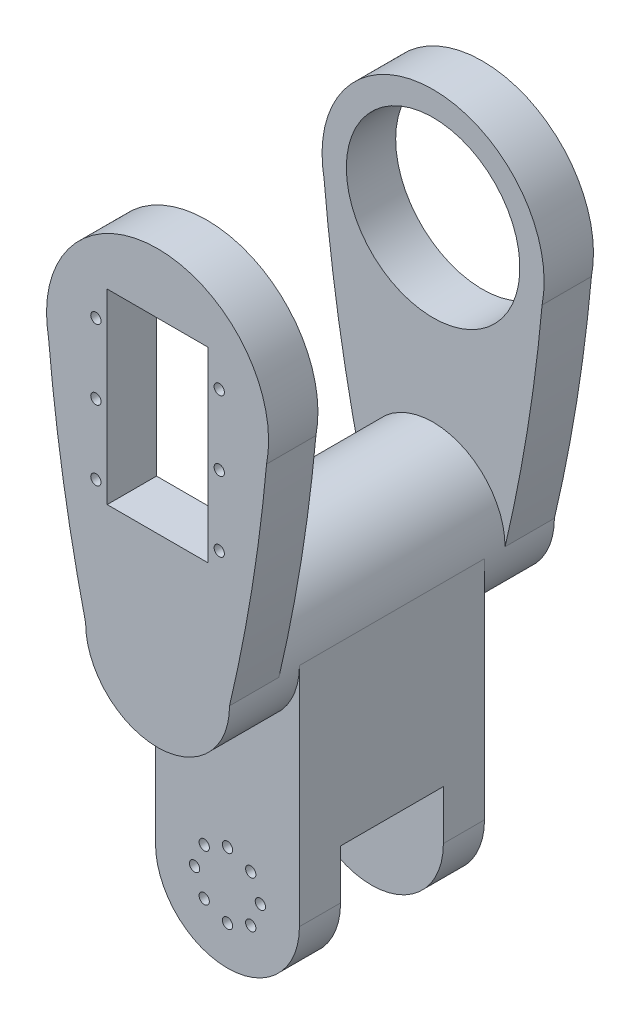
from build123d import *
from build123d.topology import SkipClean

# Parameters (mm, degrees)
BOSS_EXTRUDE1_DEPTH  = 45
BOSS_EXTRUDE2_DEPTH  = 5
BOSS_EXTRUDE3_DEPTH  = 12
BOSS_EXTRUDE4_START  = 5
BOSS_EXTRUDE4_DEPTH  = 5
BOSS_EXTRUDE5_START  = 12
BOSS_EXTRUDE5_DEPTH  = 12
BOSS_EXTRUDE6_START  = -12
BOSS_EXTRUDE6_DEPTH  = 12
BOSS_EXTRUDE7_DEPTH  = 12
CUT_EXTRUDE3_DEPTH   = 12
SKETCH15_R           = 21.100000000000012
CUT_EXTRUDE4_DEPTH   = 12
CUT_EXTRUDE5_DEPTH   = 139.06975520310718
SKETCH21_R           = 1.2500000000000013
SKETCH21_R_2         = 1.2500000000000016
SKETCH21_R_3         = 1.2500000000000036
SKETCH21_R_4         = 1.2500000000000064
SKETCH21_R_5         = 1.2500000000000004
SKETCH21_R_6         = 1.250000000000002
CUT_EXTRUDE7_DEPTH   = 12
SKETCH23_R           = 10.100000000000001
BOSS_EXTRUDE8_DEPTH  = 6
SKETCH24_R           = 8.5
CUT_EXTRUDE8_DEPTH   = 6
SKETCH25_R           = 2.7
CUT_EXTRUDE9_DEPTH   = 18
BOSS_EXTRUDE9_START  = -12
BOSS_EXTRUDE9_DEPTH  = 12
SKETCH30_R           = 1.2500000000000013
CUT_EXTRUDE11_DEPTH  = 12
SKETCH31_R           = 2.0000000000000036
SKETCH31_R_2         = 2.0000000000000067
SKETCH31_R_3         = 2
CUT_EXTRUDE12_DEPTH  = 2.5
BOSS_EXTRUDE11_DEPTH = 12


with BuildPart() as part:
    # Sketch2 → Boss-Extrude1 (new body)
    with BuildSketch(Plane.XY):
        with BuildLine():
            Line((-17.5, 27.5), (-17.5, -27.5))
            ThreePointArc((-17.5, -27.500000000000004), (3.74e-15, -45), (17.500000000000007, -27.5))
            Line((17.500000000000007, -27.5), (17.5, 27.5))
            ThreePointArc((17.5, 27.500000000000004), (7e-16, 45), (-17.5, 27.5))
        make_face()
    extrude(amount=BOSS_EXTRUDE1_DEPTH)

    # Sketch5 → Boss-Extrude2 (add)
    with BuildSketch(Plane.XY.offset(45)):
        with BuildLine():
            ThreePointArc((17.5, 27.5), (1.07e-15, 45), (-17.5, 27.5))
            ThreePointArc((-17.5, 27.5), (-3.21e-15, 10), (17.5, 27.5))
        make_face()
    extrude(amount=BOSS_EXTRUDE2_DEPTH)

    # Sketch6 → Boss-Extrude3 (add)
    with BuildSketch(Plane.XY.offset(49.99999999999999)):
        with BuildLine():
            Line((17.5, 27.5), (17.499999999999996, 67.5))
            ThreePointArc((17.499999999999996, 67.5), (-1.59e-15, 85), (-17.500000000000004, 67.5))
            Line((-17.5, 67.5), (-17.5, 27.5))
            ThreePointArc((-17.5, 27.5), (1.8e-16, 10.000000000000004), (17.5, 27.500000000000004))
        make_face()
    extrude(amount=BOSS_EXTRUDE3_DEPTH)

    # Sketch7 → Boss-Extrude4 (add)
    with BuildSketch(Plane(origin=(0, 0, 0), x_dir=(-1, 0, 0), z_dir=(0, 0, -1)).offset(BOSS_EXTRUDE4_START)):
        with BuildLine():
            ThreePointArc((17.5, 27.5), (1.07e-15, 10), (-17.5, 27.5))
            ThreePointArc((-17.5, 27.5), (1.07e-15, 45), (17.5, 27.5))
        make_face()
    extrude(amount=-BOSS_EXTRUDE4_DEPTH)

    # Sketch8 → Boss-Extrude5 (add)
    with BuildSketch(Plane(origin=(0, 0, -5), x_dir=(-1, 0, 0), z_dir=(0, 0, -1)).offset(BOSS_EXTRUDE5_START)):
        with BuildLine():
            Line((-17.499999999999996, 67.5), (-17.5, 27.5))
            ThreePointArc((-17.5, 27.5), (-1.96e-15, 10), (17.5, 27.499999999999996))
            Line((17.5, 27.5), (17.5, 67.5))
            ThreePointArc((17.5, 67.5), (1.96e-15, 85), (-17.5, 67.5))
        make_face()
    extrude(amount=-BOSS_EXTRUDE5_DEPTH)

    # Sketch11 → Boss-Extrude6 (add)
    with BuildSketch(Plane.XY.offset(62).offset(BOSS_EXTRUDE6_START)):
        with BuildLine():
            Line((-17.5, 67.5), (-17.5, 27.5))
            ThreePointArc((-17.5, 27.5), (-3.21e-15, 10), (17.5, 27.5))
            Line((17.5, 27.5), (17.499999999999996, 67.5))
            ThreePointArc((17.499999999999996, 67.5), (-6.69e-15, 115.06088519495209), (-17.5, 67.5))
        make_face()
    extrude(amount=BOSS_EXTRUDE6_DEPTH)

    # Sketch12 → Boss-Extrude7 (add)
    with BuildSketch(Plane(origin=(0, 0, -17), x_dir=(-1, 0, 0), z_dir=(0, 0, -1))):
        with BuildLine():
            ThreePointArc((17.5, 67.5), (-2.61e-15, 115.06088519495209), (-17.499999999999996, 67.5))
            ThreePointArc((-17.499999999999996, 67.5), (2.81e-15, 85), (17.5, 67.5))
        make_face()
    extrude(amount=-BOSS_EXTRUDE7_DEPTH)

    # Sketch14 → Cut-Extrude3 (cut)
    with BuildSketch(Plane.XY.offset(62)):
        Polygon((-12.25, 100.41088519495209), (12.25, 100.41088519495209), (12.250000000000004, 55.01088519495209), (-12.249999999999996, 55.01088519495209), align=None)
    extrude(amount=-CUT_EXTRUDE3_DEPTH, mode=Mode.SUBTRACT)

    # Sketch15 → Cut-Extrude4 (cut)
    with BuildSketch(Plane(origin=(0, 0, -17), x_dir=(-1, 0, 0), z_dir=(0, 0, -1))):
        with Locations((1.73e-15, 88.06088519495209)):
            Circle(SKETCH15_R)
    extrude(amount=-CUT_EXTRUDE4_DEPTH, mode=Mode.SUBTRACT)

    # Sketch17 → Cut-Extrude5 (cut, through all)
    with SkipClean():  # the faces are left unmerged after this step: merging them gives an invalid solid
        with BuildSketch(Plane.ZY.offset(17.5)):
            Polygon((9.999999999999995, -15.499999999999993), (9.999999999999998, -45.00000000000001), (34.99999999999999, -45.00000000000001), (34.99999999999999, -27.499999999999993), (34.99999999999999, -15.499999999999993), align=None)
        extrude(amount=-CUT_EXTRUDE5_DEPTH, mode=Mode.SUBTRACT)

    # Sketch21 → Cut-Extrude7 (cut)
    with SkipClean():  # the faces are left unmerged after this step: merging them gives an invalid solid
        with BuildSketch(Plane.XY.offset(45)):
            with Locations((8, -27.5)):
                Circle(SKETCH21_R)
            with Locations((5.656854249492371, -33.15685424949239)):
                Circle(SKETCH21_R_2)
            with Locations((-2.776e-14, -35.50000000000001)):
                Circle(SKETCH21_R_3)
            with Locations((-5.656854249492409, -33.15685424949234)):
                Circle(SKETCH21_R_4)
            with Locations((-8.000000000000002, -27.499999999999943)):
                Circle(SKETCH21_R_2)
            with Locations((-5.656854249492327, -21.84314575050757)):
                Circle(SKETCH21_R_3)
            with Locations((8.327e-14, -19.5)):
                Circle(SKETCH21_R_5)
            with Locations((5.656854249492453, -21.843145750507688)):
                Circle(SKETCH21_R_6)
        extrude(amount=-CUT_EXTRUDE7_DEPTH, mode=Mode.SUBTRACT)

    # Sketch23 → Boss-Extrude8 (add)
    with SkipClean():  # the faces are left unmerged after this step: merging them gives an invalid solid
        with BuildSketch(Plane(origin=(0, 0, 0), x_dir=(-1, 0, 0), z_dir=(0, 0, -1))):
            with Locations((0, -27.5)):
                Circle(SKETCH23_R)
        extrude(amount=BOSS_EXTRUDE8_DEPTH)

    # Sketch24 → Cut-Extrude8 (cut)
    with SkipClean():  # the faces are left unmerged after this step: merging them gives an invalid solid
        with BuildSketch(Plane(origin=(0, 0, -6), x_dir=(-1, 0, 0), z_dir=(0, 0, -1))):
            with Locations((0, -27.5)):
                Circle(SKETCH24_R)
        extrude(amount=-CUT_EXTRUDE8_DEPTH, mode=Mode.SUBTRACT)

    # Sketch25 → Cut-Extrude9 (cut)
    with SkipClean():  # the faces are left unmerged after this step: merging them gives an invalid solid
        with BuildSketch(Plane(origin=(0, 0, 0), x_dir=(-1, 0, 0), z_dir=(0, 0, -1))):
            with Locations((0, -27.5)):
                Circle(SKETCH25_R)
        extrude(amount=-CUT_EXTRUDE9_DEPTH, mode=Mode.SUBTRACT)

    # Sketch26 → Boss-Extrude9 (add)
    with SkipClean():  # the faces are left unmerged after this step: merging them gives an invalid solid
        with BuildSketch(Plane.XY.offset(62).offset(BOSS_EXTRUDE9_START)):
            with BuildLine():
                ThreePointArc((-17.500000000000004, 67.50000000000001), (-23.313699366711795, 74.4420959007974), (-26.505269682203256, 82.91591881278035))
                ThreePointArc((-26.505269682203163, 82.91591881278036), (-22.976087168602874, 55.04977019073297), (-17.499999999999943, 27.5))
                Line((-17.5, 27.5), (-17.5, 67.5))
            make_face()
            with BuildLine():
                ThreePointArc((17.500000000000114, 27.5), (22.97608716860276, 55.049770190732346), (26.50526968220305, 82.9159188127791))
                ThreePointArc((26.50526968220299, 82.9159188127791), (23.313699366711454, 74.44209590079687), (17.499999999999986, 67.50000000000001))
                Line((17.499999999999996, 67.5), (17.5, 27.5))
            make_face()
        extrude(amount=BOSS_EXTRUDE9_DEPTH)

    # Sketch30 → Cut-Extrude11 (cut)
    with SkipClean():  # the faces are left unmerged after this step: merging them gives an invalid solid
        with BuildSketch(Plane.XY.offset(62)):
            with Locations((15.000000000000004, 92.91088519495209)):
                Circle(SKETCH30_R)
            with Locations((15.00000000000018, 75.91088519495207)):
                Circle(SKETCH30_R)
            with Locations((15.000000000000357, 58.91088519495208)):
                Circle(SKETCH30_R)
            with Locations((-15, 92.91088519495209)):
                Circle(SKETCH30_R)
            with Locations((-15.000000000000172, 75.91088519495207)):
                Circle(SKETCH30_R)
            with Locations((-15.000000000000343, 58.91088519495207)):
                Circle(SKETCH30_R)
        extrude(amount=-CUT_EXTRUDE11_DEPTH, mode=Mode.SUBTRACT)

    # Sketch31 → Cut-Extrude12 (cut)
    with SkipClean():  # the faces are left unmerged after this step: merging them gives an invalid solid
        with BuildSketch(Plane(origin=(0, 0, 49.99999999999999), x_dir=(-1, 0, 0), z_dir=(0, 0, -1))):
            with Locations((15, 92.91088519495209)):
                Circle(SKETCH31_R)
            with Locations((15.000000000000176, 75.91088519495207)):
                Circle(SKETCH31_R_2)
            with Locations((15.000000000000353, 58.91088519495208)):
                Circle(SKETCH31_R)
            with Locations((-15.00000000000034, 58.91088519495207)):
                Circle(SKETCH31_R_3)
            with Locations((-15.000000000000169, 75.91088519495207)):
                Circle(SKETCH31_R_3)
            with Locations((-14.999999999999996, 92.91088519495209)):
                Circle(SKETCH31_R_3)
        extrude(amount=-CUT_EXTRUDE12_DEPTH, mode=Mode.SUBTRACT)

    # Sketch32 → Boss-Extrude11 (add)
    with BuildSketch(Plane(origin=(0, 0, -17), x_dir=(-1, 0, 0), z_dir=(0, 0, -1))):
        with BuildLine():
            ThreePointArc((-17.500000000000014, 67.50000000000001), (-23.313699366709606, 74.44209590079366), (-26.505269682201586, 82.91591881277179))
            ThreePointArc((-26.505269682201458, 82.91591881277179), (-22.976087168599463, 55.049770190729106), (-17.5, 27.5))
            Line((-17.5, 27.5), (-17.499999999999996, 67.5))
        make_face()
        with BuildLine():
            ThreePointArc((17.499999999999943, 27.500000000000014), (22.976087168602476, 55.04977019073189), (26.50526968220288, 82.91591881277813))
            ThreePointArc((26.505269682202822, 82.91591881277813), (23.313699366711223, 74.44209590079643), (17.5, 67.5))
            Line((17.5, 67.5), (17.5, 27.5))
        make_face()
    extrude(amount=-BOSS_EXTRUDE11_DEPTH)


solid = part.part
